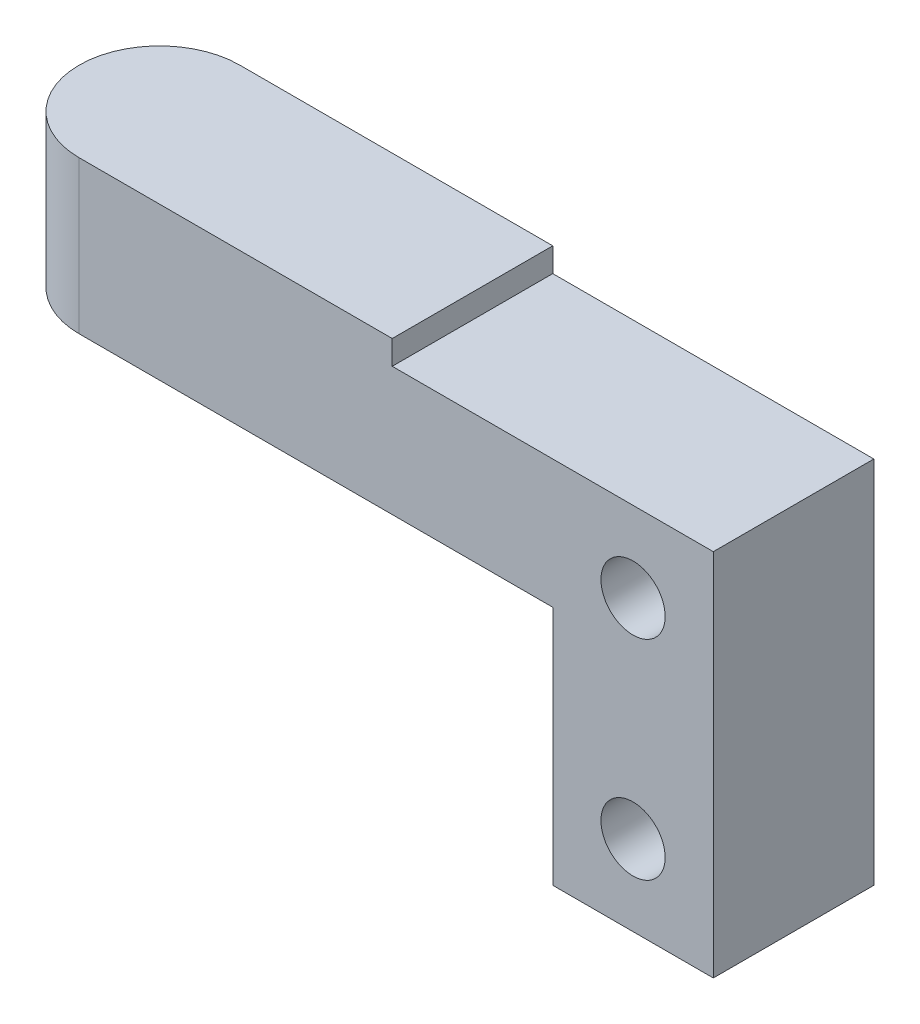
from build123d import *

# Parameters (mm, degrees)
BOSS_EXTRUDE1_DEPTH    = 10
SKETCH2_W              = 20
SKETCH2_H              = 17.246462599
CUT_EXTRUDE1_DEPTH     = 2
FILLET1_R              = 5
SKETCH4_R              = 2.5
CUT_EXTRUDE4_DEPTH     = 5
SKETCH6_W              = 10
SKETCH6_H              = 10
BOSS_EXTRUDE2_DEPTH    = 15
SKETCH5_R              = 2
CUT_EXTRUDE5_DEPTH     = 7
CUT_EXTRUDE6_START     = -0.5
CUT_EXTRUDE6_OUTLINE_W = 25.5
CUT_EXTRUDE6_OUTLINE_H = 12
CUT_EXTRUDE6_DEPTH     = 0.5


# Read off the part's stored shape, not the designer's step: Cut-Extrude6
with BuildPart() as part:
    # Sketch1 → Boss-Extrude1 (new body)
    with BuildSketch(Plane(origin=(0, 0, 0), x_dir=(1, 0, 0), z_dir=(0, 1, 0))):
        Polygon((0, 0), (34.5, 0), (44.5, 0), (44.5, 10), (0, 10), align=None)
    extrude(amount=BOSS_EXTRUDE1_DEPTH)

    # Sketch2 → Cut-Extrude1 (cut)
    with BuildSketch(Plane(origin=(0, 10, 0), x_dir=(1, 0, 0), z_dir=(0, 1, 0))):
        with Locations((34.5, 1.3767687)):
            Rectangle(SKETCH2_W, SKETCH2_H)
    extrude(amount=-CUT_EXTRUDE1_DEPTH, mode=Mode.SUBTRACT)

    # Fillet1
    fillet1_edges = [part.edges().sort_by_distance(p)[0] for p in [
        (0, 5, -10),
        (0, 5, 0),
    ]]
    fillet(fillet1_edges, radius=FILLET1_R - 0.0001)  # a hair under: the kernel refuses the full size

    # Sketch4 → Cut-Extrude4 (cut)
    with BuildSketch(Plane.XZ):
        with Locations(Location((6.5, -5, 0), (0, 0, 270))):
            Circle(SKETCH4_R)
    extrude(amount=-CUT_EXTRUDE4_DEPTH, mode=Mode.SUBTRACT)

    # Sketch6 → Boss-Extrude2 (add)
    with BuildSketch(Plane.XZ):
        with Locations((39.5, -5)):
            Rectangle(SKETCH6_W, SKETCH6_H)
    extrude(amount=BOSS_EXTRUDE2_DEPTH)

    # Sketch5 → Cut-Extrude5 (cut)
    with BuildSketch(Plane.XY):
        with Locations((39.5, 3)):
            Circle(SKETCH5_R)
        with Locations((39.5, -10)):
            Circle(SKETCH5_R)
    extrude(amount=-CUT_EXTRUDE5_DEPTH, mode=Mode.SUBTRACT)

    # Cut-Extrude6 outline → Cut-Extrude6 (cut)
    with BuildSketch(Plane(origin=(0, 10, 0), x_dir=(1, 0, 0), z_dir=(0, 1, 0)).offset(CUT_EXTRUDE6_START)):
        with Locations((11.75, 5)):
            Rectangle(CUT_EXTRUDE6_OUTLINE_W, CUT_EXTRUDE6_OUTLINE_H)
    extrude(amount=CUT_EXTRUDE6_DEPTH, mode=Mode.SUBTRACT)


solid = part.part
